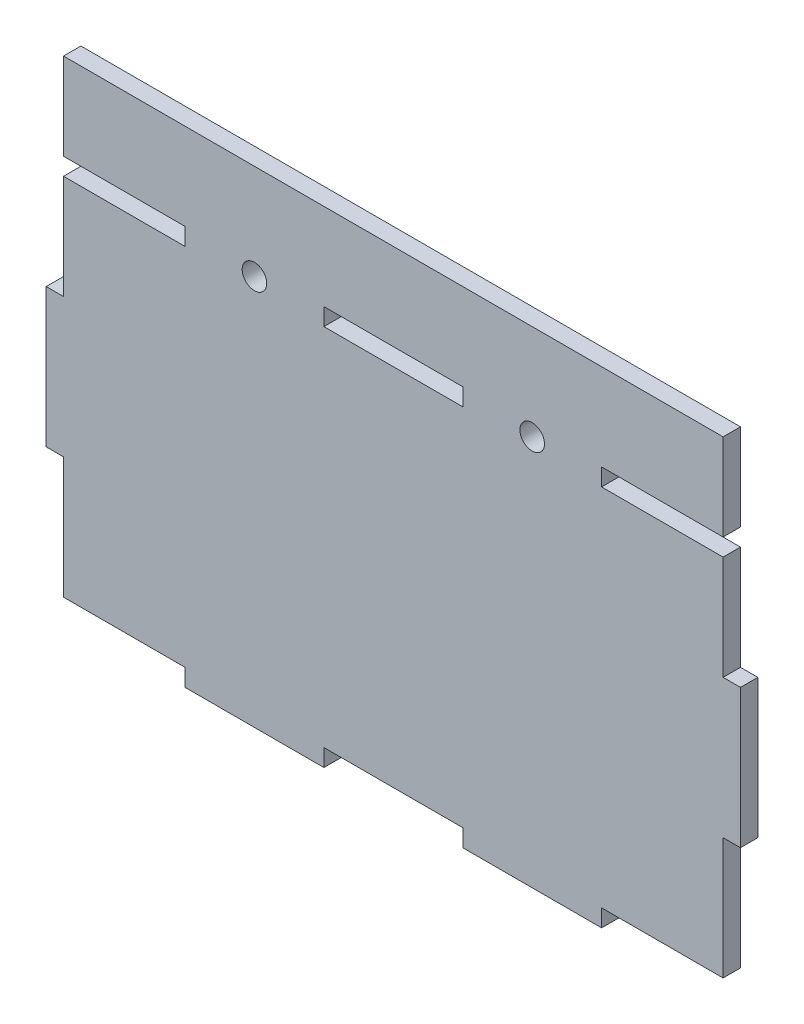
from build123d import *

# Parameters (mm, degrees)
SKETCH1_W                 = 127
SKETCH1_H                 = 88.9
BOSS_EXTRUDE1_DEPTH       = 3.175
SKETCH5_W                 = 3.175
SKETCH5_H                 = 25.4
CUT_EXTRUDE4_DEPTH        = 6.35
SKETCH6_W                 = 25.4
SKETCH6_H                 = 3.175
CUT_EXTRUDE5_DEPTH        = 6.35
LPATTERN5_COUNT           = 2
LPATTERN5_PITCH           = 50.8
LPATTERN5_COUNT_DIR2      = 2
LPATTERN5_PITCH_DIR2      = 123.825
LPATTERN6_COUNT           = 3
LPATTERN6_PITCH           = 50.8
LPATTERN6_COUNT_DIR2      = 2
LPATTERN6_PITCH_DIR2      = 69.85
F_8_CLEARANCE_HOLE1_D     = 4.4958
F_8_CLEARANCE_HOLE1_DEPTH = 10.16
F_8_CLEARANCE_HOLE1_TIP   = 1.350674586
SKETCH11_W                = 3.175
SKETCH11_H                = 12.7
CUT_EXTRUDE6_DEPTH        = 7.62


with BuildPart() as part:
    # Sketch1 → Boss-Extrude1 (new body)
    with BuildSketch(Plane.XY):
        with Locations((63.5, 44.45)):
            Rectangle(SKETCH1_W, SKETCH1_H)
    extrude(amount=BOSS_EXTRUDE1_DEPTH)

    # Sketch5 → Cut-Extrude4 (cut)
    with BuildSketch(Plane.XY.offset(3.175)):
        with Locations((1.5875, 12.7)):
            Rectangle(SKETCH5_W, SKETCH5_H)
    cut_extrude4 = extrude(amount=-CUT_EXTRUDE4_DEPTH, mode=Mode.SUBTRACT)

    # Sketch6 → Cut-Extrude5 (cut)
    with BuildSketch(Plane.XY.offset(3.175)):
        with Locations((12.7, 1.5875)):
            Rectangle(SKETCH6_W, SKETCH6_H)
    cut_extrude5 = extrude(amount=-CUT_EXTRUDE5_DEPTH, mode=Mode.SUBTRACT)

    # LPattern5: Cut-Extrude4 2 × 2
    with Locations(*[(j * LPATTERN5_PITCH_DIR2, i * LPATTERN5_PITCH, 0) for i in range(LPATTERN5_COUNT) for j in range(LPATTERN5_COUNT_DIR2) if (i, j) != (0, 0)]):
        add(cut_extrude4, mode=Mode.SUBTRACT)

    # LPattern6: Cut-Extrude5 3 × 2
    with Locations(*[(i * LPATTERN6_PITCH, j * LPATTERN6_PITCH_DIR2, 0) for i in range(LPATTERN6_COUNT) for j in range(LPATTERN6_COUNT_DIR2) if (i, j) != (0, 0)]):
        add(cut_extrude5, mode=Mode.SUBTRACT)

    # #8 Clearance Hole1
    with Locations(Plane.XY.offset(3.175)):
        with Locations((38.1, 71.4375), (88.9, 71.4375)):
            Hole(F_8_CLEARANCE_HOLE1_D / 2, depth=F_8_CLEARANCE_HOLE1_DEPTH)
            with Locations((0, 0, -(F_8_CLEARANCE_HOLE1_DEPTH + F_8_CLEARANCE_HOLE1_TIP / 2))):  # 118° drill point
                Cone(0, F_8_CLEARANCE_HOLE1_D / 2, F_8_CLEARANCE_HOLE1_TIP, mode=Mode.SUBTRACT)

    # Sketch11 → Cut-Extrude6 (cut)
    with BuildSketch(Plane.XY.offset(3.175)):
        with Locations((1.5875, 82.55)):
            Rectangle(SKETCH11_W, SKETCH11_H)
        with Locations((125.4125, 82.55)):
            Rectangle(SKETCH11_W, SKETCH11_H)
    extrude(amount=-CUT_EXTRUDE6_DEPTH, mode=Mode.SUBTRACT)


solid = part.part
